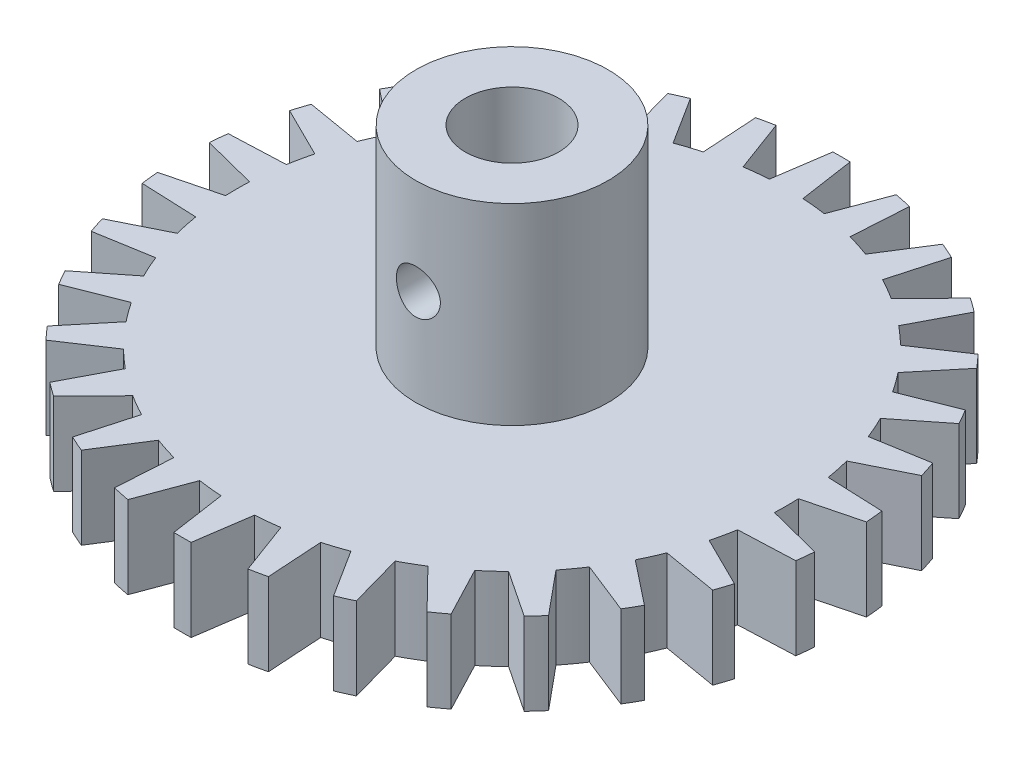
from build123d import *

# Parameters (mm, degrees)
BOSS_EXTRUDE1_DEPTH     = 3
SKETCH3_R               = 3.5
BOSS_EXTRUDE2_DEPTH     = 7
CUT_EXTRUDE1_DEPTH      = 19.333400135
CUT_EXTRUDE1_DEPTH_BACK = 19.333400135
SKETCH2_R               = 1.7
SKETCH4_R               = 0.8
CUT_EXTRUDE2_DEPTH      = 20.675201664


with BuildPart() as part:
    # Sketch1 → Boss-Extrude1 (new body)
    with BuildSketch(Plane(origin=(0, 0, 0), x_dir=(1, 0, 0), z_dir=(0, 1, 0))):
        with BuildLine():
            Line((-0.31412338, 11.9958879), (-0.610485395, 9.981347984))
            ThreePointArc((-0.610485395, 9.981347984), (-0.828082075, 9.965655025), (-1.045284633, 9.945218954))
            ThreePointArc((-1.045284633, 9.945218954), (-1.261989691, 9.920049497), (-1.478094111, 9.890158634))
            Line((-1.478094111, 9.890158634), (-2.186826306, 11.799058891))
            ThreePointArc((-2.186826306, 11.799058891), (-2.49494029, 11.737771209), (-2.801344366, 11.668439045))
            Line((-2.801344366, 11.668439045), (-2.672383761, 9.636304532))
            ThreePointArc((-2.672383761, 9.636304532), (-2.881962681, 9.575713608), (-3.090169944, 9.510565163))
            ThreePointArc((-3.090169944, 9.510565163), (-3.296906453, 9.440890204), (-3.502073813, 9.366721892))
            Line((-3.502073813, 9.366721892), (-4.592201188, 11.08655439))
            ThreePointArc((-4.592201188, 11.08655439), (-4.880839717, 10.962545492), (-5.166133162, 10.831023412))
            Line((-5.166133162, 10.831023412), (-4.617486132, 8.870108332))
            ThreePointArc((-4.617486132, 8.870108332), (-4.809887689, 8.767267557), (-5, 8.660254038))
            ThreePointArc((-5, 8.660254038), (-5.187732582, 8.549118707), (-5.372996083, 8.433914458))
            Line((-5.372996083, 8.433914458), (-6.796874843, 9.889514263))
            ThreePointArc((-6.796874843, 9.889514263), (-7.053423028, 9.708203932), (-7.305137148, 9.520240083))
            Line((-7.305137148, 9.520240083), (-6.360782203, 7.716245834))
            ThreePointArc((-6.360782203, 7.716245834), (-6.527597525, 7.575649844), (-6.691306064, 7.431448255))
            ThreePointArc((-6.691306064, 7.431448255), (-6.851829903, 7.283709699), (-7.009092643, 7.132504492))
            Line((-7.009092643, 7.132504492), (-8.704492452, 8.260254908))
            ThreePointArc((-8.704492452, 8.260254908), (-8.917737906, 8.029567276), (-9.124871587, 7.79337658))
            Line((-9.124871587, 7.79337658), (-7.826081569, 6.225146366))
            ThreePointArc((-7.826081569, 6.225146366), (-7.960020025, 6.05293988), (-8.090169944, 5.877852523))
            ThreePointArc((-8.090169944, 5.877852523), (-8.216469379, 5.699967626), (-8.338858221, 5.519369853))
            Line((-8.338858221, 5.519369853), (-10.231681972, 6.269982777))
            ThreePointArc((-10.231681972, 6.269982777), (-10.392304845, 6), (-10.545805352, 5.725905123))
            Line((-10.545805352, 5.725905123), (-8.949343616, 4.461978131))
            ThreePointArc((-8.949343616, 4.461978131), (-9.044551455, 4.265687399), (-9.135454576, 4.067366431))
            ThreePointArc((-9.135454576, 4.067366431), (-9.222009717, 3.867109616), (-9.30417568, 3.665012267))
            Line((-9.30417568, 3.665012267), (-11.311697893, 4.005682311))
            ThreePointArc((-11.311697893, 4.005682311), (-11.412678196, 3.708203932), (-11.505836818, 3.408184136))
            Line((-11.505836818, 3.408184136), (-9.681476404, 2.503800041))
            ThreePointArc((-9.681476404, 2.503800041), (-9.733792585, 2.292003909), (-9.781476007, 2.079116908))
            ThreePointArc((-9.781476007, 2.079116908), (-9.824503977, 1.86524036), (-9.862856015, 1.650476059))
            Line((-9.862856015, 1.650476059), (-11.897338336, 1.566314307))
            ThreePointArc((-11.897338336, 1.566314307), (-11.934262744, 1.254341559), (-11.963008005, 0.941509149))
            Line((-11.963008005, 0.941509149), (-9.990482216, 0.436193874))
            ThreePointArc((-9.990482216, 0.436193874), (-9.997620271, 0.21814885), (-10, 0))
            ThreePointArc((-10, 0), (-9.997620271, -0.21814885), (-9.990482216, -0.436193874))
            Line((-9.990482216, -0.436193874), (-11.963008005, -0.941509149))
            ThreePointArc((-11.963008005, -0.941509149), (-11.934262744, -1.254341559), (-11.897338336, -1.566314307))
            Line((-11.897338336, -1.566314307), (-9.862856015, -1.650476059))
            ThreePointArc((-9.862856015, -1.650476059), (-9.824503977, -1.86524036), (-9.781476007, -2.079116908))
            ThreePointArc((-9.781476007, -2.079116908), (-9.733792585, -2.292003909), (-9.681476404, -2.503800041))
            Line((-9.681476404, -2.503800041), (-11.505836818, -3.408184136))
            ThreePointArc((-11.505836818, -3.408184136), (-11.412678196, -3.708203932), (-11.311697893, -4.005682311))
            Line((-11.311697893, -4.005682311), (-9.30417568, -3.665012267))
            ThreePointArc((-9.30417568, -3.665012267), (-9.222009717, -3.867109616), (-9.135454576, -4.067366431))
            ThreePointArc((-9.135454576, -4.067366431), (-9.044551455, -4.265687399), (-8.949343616, -4.461978131))
            Line((-8.949343616, -4.461978131), (-10.545805352, -5.725905123))
            ThreePointArc((-10.545805352, -5.725905123), (-10.392304845, -6), (-10.231681972, -6.269982777))
            Line((-10.231681972, -6.269982777), (-8.338858221, -5.519369853))
            ThreePointArc((-8.338858221, -5.519369853), (-8.216469379, -5.699967626), (-8.090169944, -5.877852523))
            ThreePointArc((-8.090169944, -5.877852523), (-7.960020025, -6.05293988), (-7.826081569, -6.225146366))
            Line((-7.826081569, -6.225146366), (-9.124871587, -7.79337658))
            ThreePointArc((-9.124871587, -7.79337658), (-8.917737906, -8.029567276), (-8.704492452, -8.260254908))
            Line((-8.704492452, -8.260254908), (-7.009092643, -7.132504492))
            ThreePointArc((-7.009092643, -7.132504492), (-6.851829903, -7.283709699), (-6.691306064, -7.431448255))
            ThreePointArc((-6.691306064, -7.431448255), (-6.527597525, -7.575649844), (-6.360782203, -7.716245834))
            Line((-6.360782203, -7.716245834), (-7.305137148, -9.520240083))
            ThreePointArc((-7.305137148, -9.520240083), (-7.053423028, -9.708203932), (-6.796874843, -9.889514263))
            Line((-6.796874843, -9.889514263), (-5.372996083, -8.433914458))
            ThreePointArc((-5.372996083, -8.433914458), (-5.187732582, -8.549118707), (-5, -8.660254038))
            ThreePointArc((-5, -8.660254038), (-4.809887689, -8.767267557), (-4.617486132, -8.870108332))
            Line((-4.617486132, -8.870108332), (-5.166133162, -10.831023412))
            ThreePointArc((-5.166133162, -10.831023412), (-4.880839717, -10.962545492), (-4.592201188, -11.08655439))
            Line((-4.592201188, -11.08655439), (-3.502073813, -9.366721892))
            ThreePointArc((-3.502073813, -9.366721892), (-3.296906453, -9.440890204), (-3.090169944, -9.510565163))
            ThreePointArc((-3.090169944, -9.510565163), (-2.881962681, -9.575713608), (-2.672383761, -9.636304532))
            Line((-2.672383761, -9.636304532), (-2.801344366, -11.668439045))
            ThreePointArc((-2.801344366, -11.668439045), (-2.49494029, -11.737771209), (-2.186826306, -11.799058891))
            Line((-2.186826306, -11.799058891), (-1.478094111, -9.890158634))
            ThreePointArc((-1.478094111, -9.890158634), (-1.261989691, -9.920049497), (-1.045284633, -9.945218954))
            ThreePointArc((-1.045284633, -9.945218954), (-0.828082075, -9.965655025), (-0.610485395, -9.981347984))
            Line((-0.610485395, -9.981347984), (-0.31412338, -11.9958879))
            ThreePointArc((-0.31412338, -11.9958879), (0, -12), (0.31412338, -11.9958879))
            Line((0.31412338, -11.9958879), (0.610485395, -9.981347984))
            ThreePointArc((0.610485395, -9.981347984), (0.828082075, -9.965655025), (1.045284633, -9.945218954))
            ThreePointArc((1.045284633, -9.945218954), (1.261989691, -9.920049497), (1.478094111, -9.890158634))
            Line((1.478094111, -9.890158634), (2.186826306, -11.799058891))
            ThreePointArc((2.186826306, -11.799058891), (2.49494029, -11.737771209), (2.801344366, -11.668439045))
            Line((2.801344366, -11.668439045), (2.672383761, -9.636304532))
            ThreePointArc((2.672383761, -9.636304532), (2.881962681, -9.575713608), (3.090169944, -9.510565163))
            ThreePointArc((3.090169944, -9.510565163), (3.296906453, -9.440890204), (3.502073813, -9.366721892))
            Line((3.502073813, -9.366721892), (4.592201188, -11.08655439))
            ThreePointArc((4.592201188, -11.08655439), (4.880839717, -10.962545492), (5.166133162, -10.831023412))
            Line((5.166133162, -10.831023412), (4.617486132, -8.870108332))
            ThreePointArc((4.617486132, -8.870108332), (4.809887689, -8.767267557), (5, -8.660254038))
            ThreePointArc((5, -8.660254038), (5.187732582, -8.549118707), (5.372996083, -8.433914458))
            Line((5.372996083, -8.433914458), (6.796874843, -9.889514263))
            ThreePointArc((6.796874843, -9.889514263), (7.053423028, -9.708203932), (7.305137148, -9.520240083))
            Line((7.305137148, -9.520240083), (6.360782203, -7.716245834))
            ThreePointArc((6.360782203, -7.716245834), (6.527597525, -7.575649844), (6.691306064, -7.431448255))
            ThreePointArc((6.691306064, -7.431448255), (6.851829903, -7.283709699), (7.009092643, -7.132504492))
            Line((7.009092643, -7.132504492), (8.704492452, -8.260254908))
            ThreePointArc((8.704492452, -8.260254908), (8.917737906, -8.029567276), (9.124871587, -7.79337658))
            Line((9.124871587, -7.79337658), (7.826081569, -6.225146366))
            ThreePointArc((7.826081569, -6.225146366), (7.960020025, -6.05293988), (8.090169944, -5.877852523))
            ThreePointArc((8.090169944, -5.877852523), (8.216469379, -5.699967626), (8.338858221, -5.519369853))
            Line((8.338858221, -5.519369853), (10.231681972, -6.269982777))
            ThreePointArc((10.231681972, -6.269982777), (10.392304845, -6), (10.545805352, -5.725905123))
            Line((10.545805352, -5.725905123), (8.949343616, -4.461978131))
            ThreePointArc((8.949343616, -4.461978131), (9.044551455, -4.265687399), (9.135454576, -4.067366431))
            ThreePointArc((9.135454576, -4.067366431), (9.222009717, -3.867109616), (9.30417568, -3.665012267))
            Line((9.30417568, -3.665012267), (11.311697893, -4.005682311))
            ThreePointArc((11.311697893, -4.005682311), (11.412678196, -3.708203932), (11.505836818, -3.408184136))
            Line((11.505836818, -3.408184136), (9.681476404, -2.503800041))
            ThreePointArc((9.681476404, -2.503800041), (9.733792585, -2.292003909), (9.781476007, -2.079116908))
            ThreePointArc((9.781476007, -2.079116908), (9.824503977, -1.86524036), (9.862856015, -1.650476059))
            Line((9.862856015, -1.650476059), (11.897338336, -1.566314307))
            ThreePointArc((11.897338336, -1.566314307), (11.934262744, -1.254341559), (11.963008005, -0.941509149))
            Line((11.963008005, -0.941509149), (9.990482216, -0.436193874))
            ThreePointArc((9.990482216, -0.436193874), (9.997620271, -0.21814885), (10, 0))
            ThreePointArc((10, 0), (9.997620271, 0.21814885), (9.990482216, 0.436193874))
            Line((9.990482216, 0.436193874), (11.963008005, 0.941509149))
            ThreePointArc((11.963008005, 0.941509149), (11.934262744, 1.254341559), (11.897338336, 1.566314307))
            Line((11.897338336, 1.566314307), (9.862856015, 1.650476059))
            ThreePointArc((9.862856015, 1.650476059), (9.824503977, 1.86524036), (9.781476007, 2.079116908))
            ThreePointArc((9.781476007, 2.079116908), (9.733792585, 2.292003909), (9.681476404, 2.503800041))
            Line((9.681476404, 2.503800041), (11.505836818, 3.408184136))
            ThreePointArc((11.505836818, 3.408184136), (11.412678196, 3.708203932), (11.311697893, 4.005682311))
            Line((11.311697893, 4.005682311), (9.30417568, 3.665012267))
            ThreePointArc((9.30417568, 3.665012267), (9.222009717, 3.867109616), (9.135454576, 4.067366431))
            ThreePointArc((9.135454576, 4.067366431), (9.044551455, 4.265687399), (8.949343616, 4.461978131))
            Line((8.949343616, 4.461978131), (10.545805352, 5.725905123))
            ThreePointArc((10.545805352, 5.725905123), (10.392304845, 6), (10.231681972, 6.269982777))
            Line((10.231681972, 6.269982777), (8.338858221, 5.519369853))
            ThreePointArc((8.338858221, 5.519369853), (8.216469379, 5.699967626), (8.090169944, 5.877852523))
            ThreePointArc((8.090169944, 5.877852523), (7.960020025, 6.05293988), (7.826081569, 6.225146366))
            Line((7.826081569, 6.225146366), (9.124871587, 7.79337658))
            ThreePointArc((9.124871587, 7.79337658), (8.917737906, 8.029567276), (8.704492452, 8.260254908))
            Line((8.704492452, 8.260254908), (7.009092643, 7.132504492))
            ThreePointArc((7.009092643, 7.132504492), (6.851829903, 7.283709699), (6.691306064, 7.431448255))
            ThreePointArc((6.691306064, 7.431448255), (6.527597525, 7.575649844), (6.360782203, 7.716245834))
            Line((6.360782203, 7.716245834), (7.305137148, 9.520240083))
            ThreePointArc((7.305137148, 9.520240083), (7.053423028, 9.708203932), (6.796874843, 9.889514263))
            Line((6.796874843, 9.889514263), (5.372996083, 8.433914458))
            ThreePointArc((5.372996083, 8.433914458), (5.187732582, 8.549118707), (5, 8.660254038))
            ThreePointArc((5, 8.660254038), (4.809887689, 8.767267557), (4.617486132, 8.870108332))
            Line((4.617486132, 8.870108332), (5.166133162, 10.831023412))
            ThreePointArc((5.166133162, 10.831023412), (4.880839717, 10.962545492), (4.592201188, 11.08655439))
            Line((4.592201188, 11.08655439), (3.502073813, 9.366721892))
            ThreePointArc((3.502073813, 9.366721892), (3.296906453, 9.440890204), (3.090169944, 9.510565163))
            ThreePointArc((3.090169944, 9.510565163), (2.881962681, 9.575713608), (2.672383761, 9.636304532))
            Line((2.672383761, 9.636304532), (2.801344366, 11.668439045))
            ThreePointArc((2.801344366, 11.668439045), (2.49494029, 11.737771209), (2.186826306, 11.799058891))
            Line((2.186826306, 11.799058891), (1.478094111, 9.890158634))
            ThreePointArc((1.478094111, 9.890158634), (1.261989691, 9.920049497), (1.045284633, 9.945218954))
            ThreePointArc((1.045284633, 9.945218954), (0.828082075, 9.965655025), (0.610485395, 9.981347984))
            Line((0.610485395, 9.981347984), (0.31412338, 11.9958879))
            ThreePointArc((0.31412338, 11.9958879), (0, 12), (-0.31412338, 11.9958879))
        make_face()
    extrude(amount=BOSS_EXTRUDE1_DEPTH)

    # Sketch3 → Boss-Extrude2 (add)
    with BuildSketch(Plane(origin=(0, 3, 0), x_dir=(1, 0, 0), z_dir=(0, 1, 0))):
        Circle(SKETCH3_R)
    extrude(amount=BOSS_EXTRUDE2_DEPTH)

    # Sketch2 → Cut-Extrude1 (cut, two sides: drawn at the far end of the back side and taken through both)
    with BuildSketch(Plane(origin=(0, 3, 0), x_dir=(1, 0, 0), z_dir=(0, 1, 0)).offset(-CUT_EXTRUDE1_DEPTH_BACK)):
        Circle(SKETCH2_R)
    extrude(amount=CUT_EXTRUDE1_DEPTH + CUT_EXTRUDE1_DEPTH_BACK, mode=Mode.SUBTRACT)

    # Sketch4 → Cut-Extrude2 (cut, through all)
    with BuildSketch(Plane.XY):
        with Locations((0, 6.5)):
            Circle(SKETCH4_R)
    extrude(amount=CUT_EXTRUDE2_DEPTH, mode=Mode.SUBTRACT)


solid = part.part
